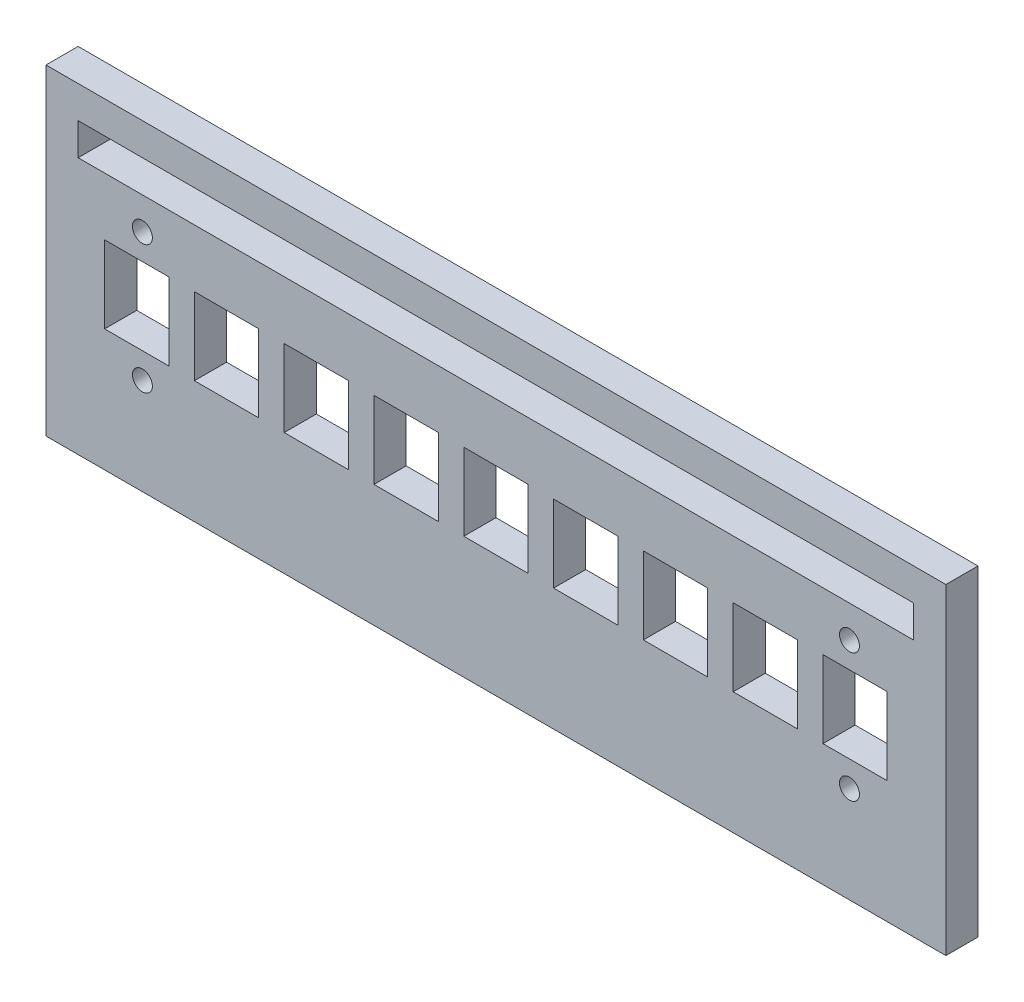
from build123d import *

# Parameters (mm, degrees)
ESQUISSE1_W        = 140
ESQUISSE1_H        = 50
ESQUISSE1_R        = 1.55
ESQUISSE1_W_2      = 10
ESQUISSE1_H_2      = 12
ESQUISSE1_W_3      = 130
ESQUISSE1_H_3      = 5
BOSS_EXTRU_1_DEPTH = 5


with BuildPart() as part:
    # Esquisse1 → Boss.-Extru.1 (new body)
    with BuildSketch(Plane.XY):
        Rectangle(ESQUISSE1_W, ESQUISSE1_H)
        with Locations((-55, -10)):
            Circle(ESQUISSE1_R, mode=Mode.SUBTRACT)
        with Locations((-55, 10)):
            Circle(ESQUISSE1_R, mode=Mode.SUBTRACT)
        with Locations((55, -10)):
            Circle(ESQUISSE1_R, mode=Mode.SUBTRACT)
        with Locations((55, 10)):
            Circle(ESQUISSE1_R, mode=Mode.SUBTRACT)
        with Locations((13.97, 0)):
            Rectangle(ESQUISSE1_W_2, ESQUISSE1_H_2, mode=Mode.SUBTRACT)
        Rectangle(ESQUISSE1_W_2, ESQUISSE1_H_2, mode=Mode.SUBTRACT)
        with Locations((27.94, 0)):
            Rectangle(ESQUISSE1_W_2, ESQUISSE1_H_2, mode=Mode.SUBTRACT)
        with Locations((41.91, 0)):
            Rectangle(ESQUISSE1_W_2, ESQUISSE1_H_2, mode=Mode.SUBTRACT)
        with Locations((55.88, 0)):
            Rectangle(ESQUISSE1_W_2, ESQUISSE1_H_2, mode=Mode.SUBTRACT)
        with Locations((-13.97, 0)):
            Rectangle(ESQUISSE1_W_2, ESQUISSE1_H_2, mode=Mode.SUBTRACT)
        with Locations((-27.94, 0)):
            Rectangle(ESQUISSE1_W_2, ESQUISSE1_H_2, mode=Mode.SUBTRACT)
        with Locations((-41.91, 0)):
            Rectangle(ESQUISSE1_W_2, ESQUISSE1_H_2, mode=Mode.SUBTRACT)
        with Locations((-55.88, 0)):
            Rectangle(ESQUISSE1_W_2, ESQUISSE1_H_2, mode=Mode.SUBTRACT)
        with Locations((0, 17.5)):
            Rectangle(ESQUISSE1_W_3, ESQUISSE1_H_3, mode=Mode.SUBTRACT)
    extrude(amount=-BOSS_EXTRU_1_DEPTH)


solid = part.part
